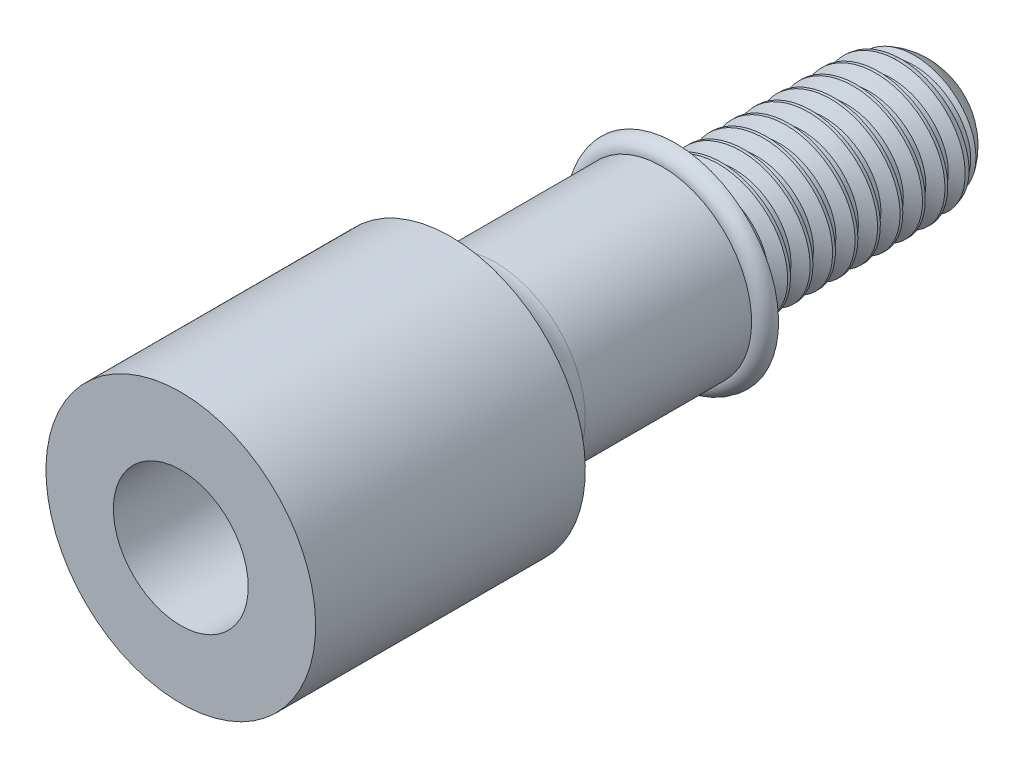
from build123d import *

# Parameters (mm, degrees)
SKETCH2_R           = 1.5
BOSS_EXTRUDE1_DEPTH = 6
FILLET1_R           = 1.3
THREAD1_PITCH       = 0.5
SKETCH6_R           = 1.5
CUT_EXTRUDE1_DEPTH  = 5
SKETCH7_R           = 1
CUT_EXTRUDE2_DEPTH  = 12.789826123


with BuildPart() as part:
    # Sketch1 → Revolve1 (revolve)
    with BuildSketch(Plane(origin=(0, 0, 0), x_dir=(0, 0, -1), z_dir=(1, 0, 0))):
        with BuildLine():
            Line((0, 0), (-11, 0))
            Line((-11, 0), (-11, 3))
            Line((-11, 3), (-5, 3))
            ThreePointArc((-5, 3), (-4.707106781, 2.292893219), (-4, 2))
            Line((-4, 2), (-0.3, 2))
            ThreePointArc((-0.3, 2), (-0.212132034, 2.212132034), (0, 2.3))
            Line((0, 2.3), (0, 0))
        make_face()
    revolve(axis=Axis((0, 0, 0), (0, 0, 1)))

    # Sketch2 → Boss-Extrude1 (add)
    with BuildSketch(Plane(origin=(0, 0, 0), x_dir=(-1, 0, 0), z_dir=(0, 0, -1))):
        with Locations(Location((0, 0, 0), (0, 0, 90))):
            Circle(SKETCH2_R)
    extrude(amount=BOSS_EXTRUDE1_DEPTH)

    # Fillet1
    fillet1_edges = [part.edges().sort_by_distance(p)[0] for p in [
        (0, -1.5, -6),
    ]]
    fillet(fillet1_edges, radius=FILLET1_R)

    # Thread1: the profile of Thread Profile1 profile screwed along a right-hand helix of 12 turns, 6 arcs to a turn; built about Z, then put on its axis
    thread1_z = Axis((0, 0, 0), (0, 0, 1))
    thread1_corners = [(1.5003, 0, -0.000173205), (1.5003, 0, 0.437673204), (1.229367063, 0, 0.281249999), (1.229367063, 0, 0.156249999)]
    with BuildLine(mode=Mode.PRIVATE) as thread1_profile:
        Line(thread1_corners[0], thread1_corners[1])
        Line(thread1_corners[1], thread1_corners[2])
        Line(thread1_corners[2], thread1_corners[3])
        Line(thread1_corners[3], thread1_corners[0])
    thread1_cap = Face(thread1_profile.wire())
    thread1_turn_angles = [0, 30, 60, 90, 120, 150, 180, 210, 240, 270, 300, 330, 360]
    thread1_turn_weights = [1, 0.8660254037844387, 1, 0.8660254037844387, 1, 0.8660254037844387, 1, 0.8660254037844387, 1, 0.8660254037844387, 1, 0.8660254037844387, 1]
    thread1_turn_rails = [Edge.make_bspline([Vector(p[0], p[1], 0).rotate(thread1_z, thread1_turn_angles[k]) / thread1_turn_weights[k] + Vector(0, 0, p[2] + THREAD1_PITCH * thread1_turn_angles[k] / 360) for k in range(13)], [0, 0, 0, 1, 1, 2, 2, 3, 3, 4, 4, 5, 5, 6, 6, 6], 2, thread1_turn_weights) for p in thread1_corners]
    thread1_turn_sides = [Face.make_surface_from_curves(thread1_turn_rails[p[0]], thread1_turn_rails[p[1]]) for p in [(0, 1), (1, 2), (2, 3), (3, 0)]]
    thread1 = Plane(origin=(0, 0, -6), x_dir=(1, 0, 0), z_dir=(0, 0, 1)) * Solid(Shell([*[p.moved(Location((0, 0, THREAD1_PITCH * i))) for i in range(12) for p in thread1_turn_sides], thread1_cap, thread1_cap.rotate(thread1_z, 4320).moved(Location((0, 0, THREAD1_PITCH * 4320 / 360)))]))
    add(thread1, mode=Mode.SUBTRACT)

    # Sketch6 → Cut-Extrude1 (cut)
    with BuildSketch(Plane.XY.offset(11)):
        Circle(SKETCH6_R)
    extrude(amount=-CUT_EXTRUDE1_DEPTH, mode=Mode.SUBTRACT)

    # Sketch7 → Cut-Extrude2 (cut, through all)
    with BuildSketch(Plane(origin=(0, 0, 0), x_dir=(0, 0, -1), z_dir=(1, 0, 0))):
        with Locations((-8, 0)):
            Circle(SKETCH7_R)
    extrude(amount=-CUT_EXTRUDE2_DEPTH, mode=Mode.SUBTRACT)


solid = part.part
